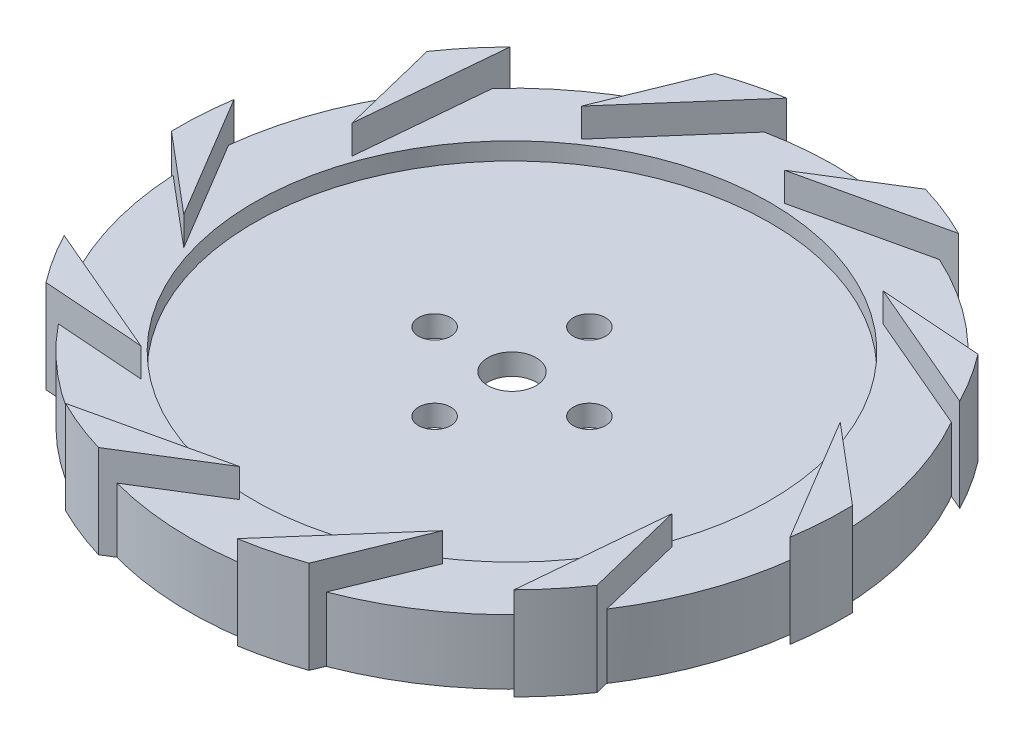
from build123d import *

# Parameters (mm, degrees)
GUIDE_START        = 3.429
GUIDE_VANES_DEPTH  = 18.288
CIRPATTERN4_COUNT  = 10
SKETCH5_R          = 60.325
HOLLOW_OUT_DEPTH   = 5.08
SKETCH6_R          = 4.7625
CUT_EXTRUDE1_DEPTH = 93.42824842
SKETCH7_R          = 3.175
CUT_EXTRUDE2_DEPTH = 93.42824842
CIRPATTERN5_COUNT  = 4


with BuildPart() as part:
    # Sketch3 → Body (revolve)
    with BuildSketch(Plane.XY):
        Polygon((-63.5, 16.0734375), (-50.8, 16.0734375), (-50.8, 12.633854167), (0, 12.633854167), (0, 3.3734375), (-63.5, 3.3734375), align=None)
    revolve(axis=Axis((0, 0, 0), (0, 1, 0)))

    # Sketch4 → Guide Vanes (add)
    with BuildSketch(Plane(origin=(0, 0, 0), x_dir=(1, 0, 0), z_dir=(0, 1, 0)).offset(GUIDE_START)):
        with BuildLine():
            Line((1.553349961, 52.076946284), (18.68699888, 62.727592909))
            ThreePointArc((18.68699888, 62.727592909), (24.16847964, 60.826305421), (29.460054596, 58.447070265))
            Line((29.460054596, 58.447070265), (1.553349961, 52.076946284))
        make_face()
    guide_vanes = extrude(amount=GUIDE_VANES_DEPTH)

    # CirPattern4: Guide Vanes ×10 about axis
    cirpattern4_axis = Axis((0, 16.0734375, 0), (0, -1, 0))
    for i in range(1, CIRPATTERN4_COUNT):
        add(guide_vanes.rotate(cirpattern4_axis, i * 360 / CIRPATTERN4_COUNT))

    # Sketch5 → Hollow out (cut)
    with BuildSketch(Plane.XZ.offset(-3.3734375)):
        Circle(SKETCH5_R)
    extrude(amount=-HOLLOW_OUT_DEPTH, mode=Mode.SUBTRACT)

    # Sketch6 → Cut-Extrude1 (cut, through all)
    with BuildSketch(Plane(origin=(0, 12.633854167, 0), x_dir=(1, 0, 0), z_dir=(0, 1, 0))):
        Circle(SKETCH6_R)
    extrude(amount=-CUT_EXTRUDE1_DEPTH, mode=Mode.SUBTRACT)

    # Sketch7 → Cut-Extrude2 (cut, through all)
    with BuildSketch(Plane(origin=(0, 12.633854167, 0), x_dir=(1, 0, 0), z_dir=(0, 1, 0))):
        with Locations((0, 15.24)):
            Circle(SKETCH7_R)
    cut_extrude2 = extrude(amount=-CUT_EXTRUDE2_DEPTH, mode=Mode.SUBTRACT)

    # CirPattern5: Cut-Extrude2 ×4 about axis
    cirpattern5_axis = Axis((0, 12.633854167, 0), (0, 1, 0))
    for i in range(1, CIRPATTERN5_COUNT):
        add(cut_extrude2.rotate(cirpattern5_axis, i * 360 / CIRPATTERN5_COUNT), mode=Mode.SUBTRACT)


solid = part.part
